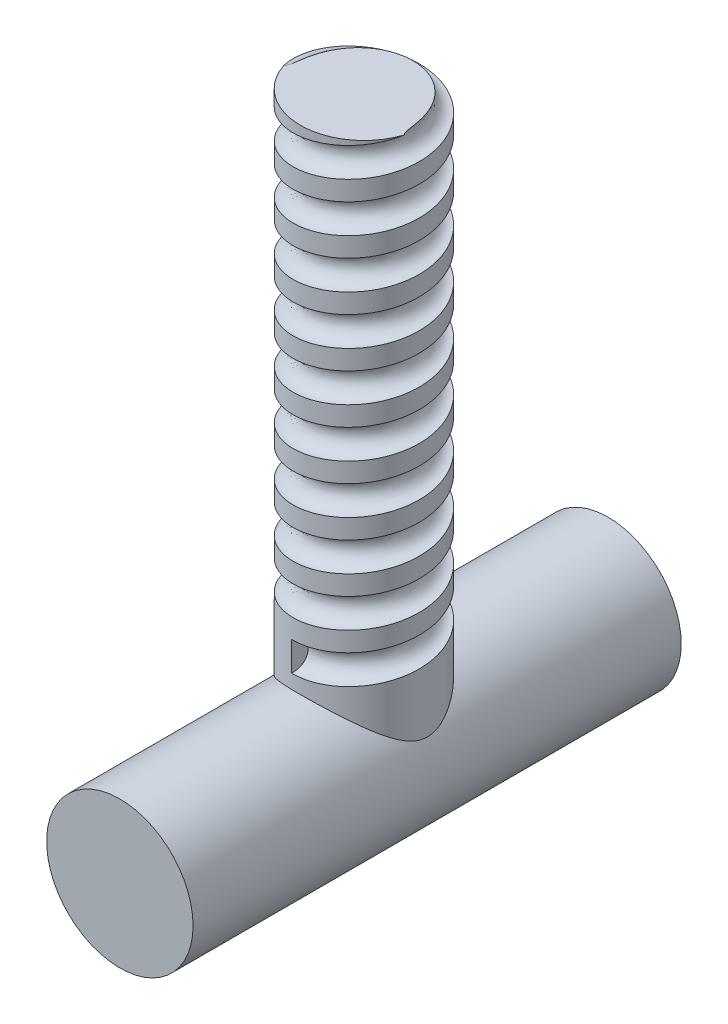
from build123d import *

# Parameters (mm, degrees)
IZIM1_R                     = 7.5
Y_KSEKLIK_EKSTR_ZYON1_DEPTH = 25
IZIM2_R                     = 6.5
Y_KSEKLIK_EKSTR_ZYON2_DEPTH = 58
KES_S_P_R1_PITCH            = 5


with BuildPart() as part:
    # Çizim1 → Yükseklik-Ekstrüzyon1 (new, symmetric)
    with BuildSketch(Plane.XY):
        Circle(IZIM1_R)
    extrude(amount=Y_KSEKLIK_EKSTR_ZYON1_DEPTH, both=True)

    # Çizim2 → Yükseklik-Ekstrüzyon2 (add)
    with BuildSketch(Plane(origin=(0, 0, 0), x_dir=(1, 0, 0), z_dir=(0, 1, 0))):
        with Locations(Location((0, 0, 0), (0, 0, 90))):
            Circle(IZIM2_R)
    extrude(amount=Y_KSEKLIK_EKSTR_ZYON2_DEPTH)

    # Kes-Süpür1: arcs per turn and ends read off the stored shape
    # Kes-Süpür1: the profile of Çizim4 screwed along a right-hand helix through 10.4 turns, 12 arcs to a turn; built about Z, then put on its axis
    kes_s_p_r1_z = Axis((0, 0, 0), (0, 0, 1))
    kes_s_p_r1_corners = [(8, 1.3963e-05, -4.374998611), (6.5, 1.1345e-05, -5.874998611), (5, 8.727e-06, -4.374998611), (6.5, 1.1345e-05, -2.874998611)]
    with BuildLine(mode=Mode.PRIVATE) as kes_s_p_r1_profile:
        ThreePointArc((8, 1.3963e-05, -4.374998611), (7.560660172, 1.3196e-05, -5.435658783), (6.5, 1.1345e-05, -5.874998611))
        ThreePointArc((6.5, 1.1345e-05, -5.874998611), (5.439339828, 9.493e-06, -5.435658783), (5, 8.727e-06, -4.374998611))
        ThreePointArc((5, 8.727e-06, -4.374998611), (5.439339828, 9.493e-06, -3.314338439), (6.5, 1.1345e-05, -2.874998611))
        ThreePointArc((6.5, 1.1345e-05, -2.874998611), (7.560660172, 1.3196e-05, -3.314338439), (8, 1.3963e-05, -4.374998611))
    kes_s_p_r1_cap = Face(kes_s_p_r1_profile.wire())
    kes_s_p_r1_arcs = [((8, 1.3963e-05, -4.374998611), (8, 1.3963e-05, -5.874998611), (6.5, 1.1345e-05, -5.874998611), (1, 0.7071067811865476, 1)), ((6.5, 1.1345e-05, -5.874998611), (5, 8.727e-06, -5.874998611), (5, 8.727e-06, -4.374998611), (1, 0.7071067811865476, 1)), ((5, 8.727e-06, -4.374998611), (5, 8.727e-06, -2.874998611), (6.5, 1.1345e-05, -2.874998611), (1, 0.7071067811865476, 1)), ((6.5, 1.1345e-05, -2.874998611), (8, 1.3963e-05, -2.874998611), (8, 1.3963e-05, -4.374998611), (1, 0.7071067811865476, 1))]  # start, shoulder, end, weights
    kes_s_p_r1_turn_angles = [0, 15, 30, 45, 60, 75, 90, 105, 120, 135, 150, 165, 180, 195, 210, 225, 240, 255, 270, 285, 300, 315, 330, 345, 360]
    kes_s_p_r1_turn_weights = [1, 0.9659258262890683, 1, 0.9659258262890683, 1, 0.9659258262890683, 1, 0.9659258262890683, 1, 0.9659258262890683, 1, 0.9659258262890683, 1, 0.9659258262890683, 1, 0.9659258262890683, 1, 0.9659258262890683, 1, 0.9659258262890683, 1, 0.9659258262890683, 1, 0.9659258262890683, 1]
    kes_s_p_r1_turn_sides = [Face.make_bezier_surface([[Vector(p[j][0], p[j][1], 0).rotate(kes_s_p_r1_z, kes_s_p_r1_turn_angles[2 * i + k]) / kes_s_p_r1_turn_weights[2 * i + k] + Vector(0, 0, p[j][2] + KES_S_P_R1_PITCH * kes_s_p_r1_turn_angles[2 * i + k] / 360) for k in range(3)] for j in range(3)], [[p[3][j] * kes_s_p_r1_turn_weights[2 * i + k] for k in range(3)] for j in range(3)]) for p in kes_s_p_r1_arcs for i in range(12)]
    kes_s_p_r1_last_angles = [3600, 3615, 3630, 3645, 3660, 3675, 3690, 3705, 3720, 3732, 3744]
    kes_s_p_r1_last_weights = [1, 0.9659258262890683, 1, 0.9659258262890683, 1, 0.9659258262890683, 1, 0.9659258262890683, 1, 0.9781476007337454, 1]
    kes_s_p_r1_last_sides = [Face.make_bezier_surface([[Vector(p[j][0], p[j][1], 0).rotate(kes_s_p_r1_z, kes_s_p_r1_last_angles[2 * i + k]) / kes_s_p_r1_last_weights[2 * i + k] + Vector(0, 0, p[j][2] + KES_S_P_R1_PITCH * kes_s_p_r1_last_angles[2 * i + k] / 360) for k in range(3)] for j in range(3)], [[p[3][j] * kes_s_p_r1_last_weights[2 * i + k] for k in range(3)] for j in range(3)]) for p in kes_s_p_r1_arcs for i in range(5)]
    kes_s_p_r1 = Plane(origin=(0, 58, 0), x_dir=(0.7071067811865438, 0, -0.7071067811865512), z_dir=(0, -1, 0)) * Solid(Shell([*[p.moved(Location((0, 0, KES_S_P_R1_PITCH * i))) for i in range(10) for p in kes_s_p_r1_turn_sides], *kes_s_p_r1_last_sides, kes_s_p_r1_cap, kes_s_p_r1_cap.rotate(kes_s_p_r1_z, 3744).moved(Location((0, 0, KES_S_P_R1_PITCH * 3744 / 360)))]))
    add(kes_s_p_r1, mode=Mode.SUBTRACT)


solid = part.part
